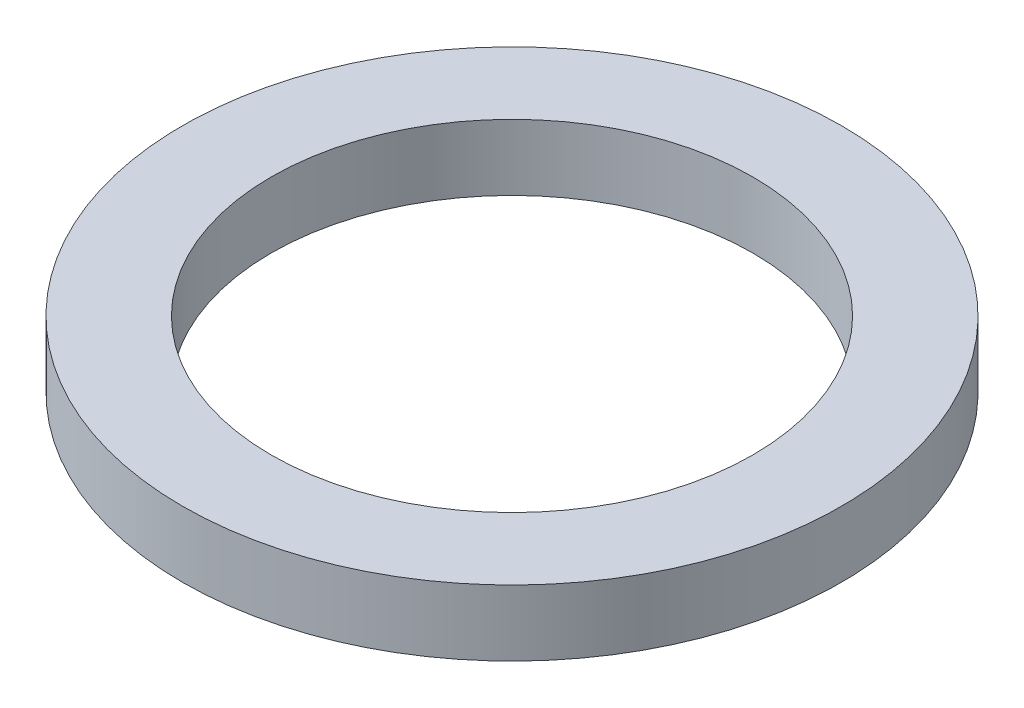
from build123d import *

# Parameters (mm, degrees)
SKETCH1_R           = 65
BOSS_EXTRUDE1_DEPTH = 13
SKETCH2_R           = 47.5
CUT_EXTRUDE1_DEPTH  = 93.838569571


with BuildPart() as part:
    # Sketch1 → Boss-Extrude1 (new body)
    with BuildSketch(Plane(origin=(0, 0, 0), x_dir=(1, 0, 0), z_dir=(0, 1, 0))):
        Circle(SKETCH1_R)
    extrude(amount=BOSS_EXTRUDE1_DEPTH)

    # Sketch2 → Cut-Extrude1 (cut, through all)
    with BuildSketch(Plane(origin=(0, 0, 0), x_dir=(1, 0, 0), z_dir=(0, 1, 0))):
        Circle(SKETCH2_R)
    extrude(amount=CUT_EXTRUDE1_DEPTH, mode=Mode.SUBTRACT)


solid = part.part
